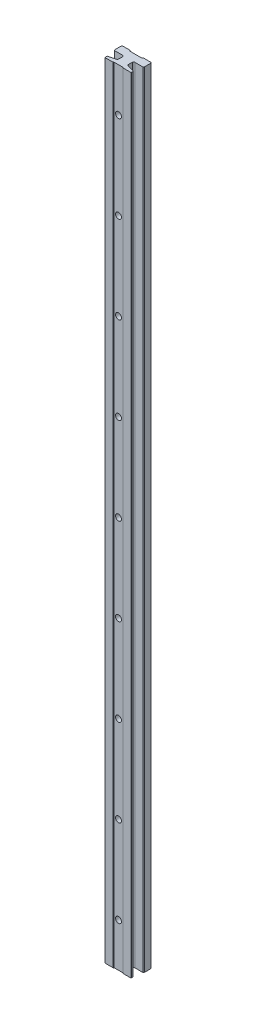
from build123d import *

# Parameters (mm, degrees)
BOSS_EXTRUDE1_DEPTH = 50
SKETCH2_R           = 1.7
CUT_EXTRUDE1_DEPTH  = 54.597014842
SKETCH3_R           = 3
CUT_EXTRUDE2_DEPTH  = 3.2
LPATTERN1_COUNT     = 9
LPATTERN1_PITCH     = 50


with BuildPart() as part:
    # Sketch1 → Boss-Extrude1 (new body)
    with BuildSketch(Plane(origin=(0, 0, 0), x_dir=(1, 0, 0), z_dir=(0, 1, 0))):
        with BuildLine():
            Line((0, 0.2), (0, 1.15))
            ThreePointArc((0, 1.15), (0.041329332, 1.271752286), (0.148236191, 1.343185165))
            Line((0.148236191, 1.343185165), (4.008819045, 2.377625223))
            ThreePointArc((4.008819045, 2.377625223), (4.54335334, 2.734789621), (4.75, 3.34355105))
            Line((4.75, 3.34355105), (4.75, 5.5))
            ThreePointArc((4.75, 5.5), (4.544974747, 5.994974747), (4.05, 6.2))
            Line((4.05, 6.2), (-0.6, 6.2))
            Line((-0.6, 6.2), (-1, 6.6))
            Line((-1, 6.6), (-1, 10.4))
            Line((-1, 10.4), (-0.6, 10.8))
            Line((-0.6, 10.8), (3.5, 10.8))
            Line((3.5, 10.8), (4, 10.3))
            Line((4, 10.3), (11, 10.3))
            Line((11, 10.3), (11.5, 10.8))
            Line((11.5, 10.8), (15.6, 10.8))
            Line((15.6, 10.8), (16, 10.4))
            Line((16, 10.4), (16, 6.6))
            Line((16, 6.6), (15.6, 6.2))
            Line((15.6, 6.2), (10.95, 6.2))
            ThreePointArc((10.95, 6.2), (10.455025253, 5.994974747), (10.25, 5.5))
            Line((10.25, 5.5), (10.25, 3.34355105))
            ThreePointArc((10.25, 3.34355105), (10.45664666, 2.734789621), (10.991180955, 2.377625223))
            Line((10.991180955, 2.377625223), (14.851763809, 1.343185165))
            ThreePointArc((14.851763809, 1.343185165), (14.958670668, 1.271752286), (15, 1.15))
            Line((15, 1.15), (15, 0.2))
            ThreePointArc((15, 0.2), (14.941421356, 0.058578644), (14.8, 0))
            Line((14.8, 0), (10.25, 0))
            Line((10.25, 0), (9.95, 0.3))
            Line((9.95, 0.3), (5.05, 0.3))
            Line((5.05, 0.3), (4.75, 0))
            Line((4.75, 0), (0.2, 0))
            ThreePointArc((0.2, 0), (0.058578644, 0.058578644), (0, 0.2))
        make_face()
    boss_extrude1 = extrude(amount=BOSS_EXTRUDE1_DEPTH)

    # Sketch2 → Cut-Extrude1 (cut, through all)
    with BuildSketch(Plane.XY):
        with Locations((7.5, 25)):
            Circle(SKETCH2_R)
    cut_extrude1 = extrude(amount=-CUT_EXTRUDE1_DEPTH, mode=Mode.SUBTRACT)

    # Sketch3 → Cut-Extrude2 (cut)
    with BuildSketch(Plane(origin=(0, 0, -10.3), x_dir=(-1, 0, 0), z_dir=(0, 0, -1))):
        with Locations((-7.5, 25)):
            Circle(SKETCH3_R)
    cut_extrude2 = extrude(amount=-CUT_EXTRUDE2_DEPTH, mode=Mode.SUBTRACT)

    # LPattern1: Boss-Extrude1, Cut-Extrude1, Cut-Extrude2 ×9
    with Locations(*[(0, -i * LPATTERN1_PITCH, 0) for i in range(1, LPATTERN1_COUNT)]):
        add(boss_extrude1)
        add(cut_extrude1, mode=Mode.SUBTRACT)
        add(cut_extrude2, mode=Mode.SUBTRACT)


solid = part.part
